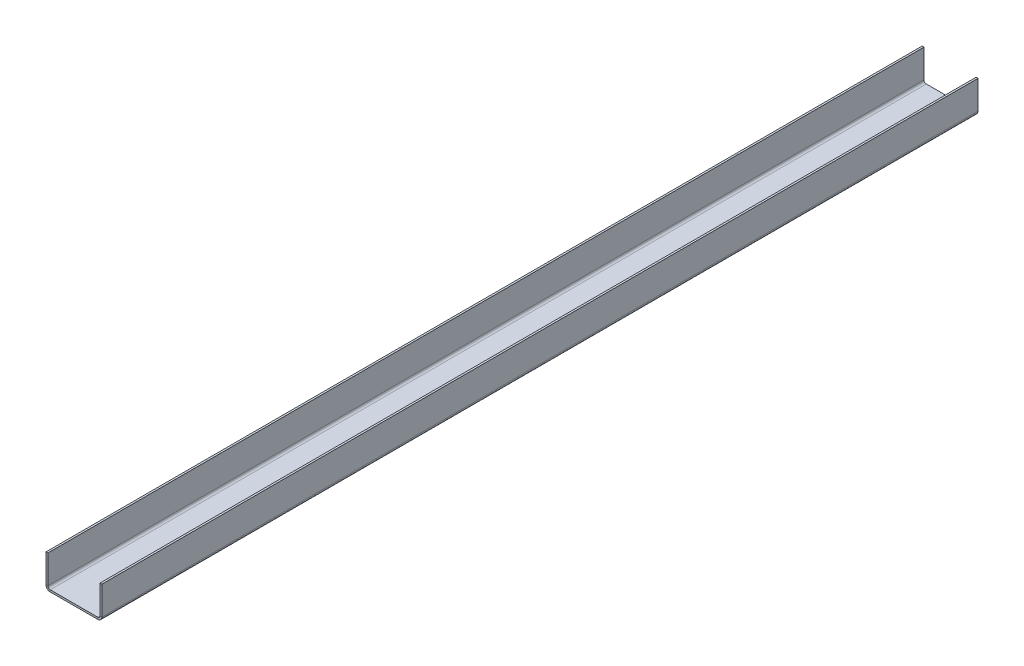
from build123d import *

# Parameters (mm, degrees)
BASE_FLANGE1_DEPTH = 1193.8


# Sheet-metal steps are written as plain solids
with BuildPart() as part:
    # Sketch1 → Base-Flange1 (new body)
    with BuildSketch(Plane.XY):
        with BuildLine():
            Line((-38.1, 44.45), (-38.1, 5.76326))
            ThreePointArc((-38.1, 5.76326), (-36.411980228, 1.688019772), (-32.33674, 0))
            Line((-32.33674, 0), (32.33674, 0))
            ThreePointArc((32.33674, 0), (36.411980228, 1.688019772), (38.1, 5.76326))
            Line((38.1, 5.76326), (38.1, 44.45))
            Line((38.1, 44.45), (35.51174, 44.45))
            Line((35.51174, 44.45), (35.51174, 5.76326))
            ThreePointArc((35.51174, 5.76326), (34.58180403, 3.51819597), (32.33674, 2.58826))
            Line((32.33674, 2.58826), (-32.33674, 2.58826))
            ThreePointArc((-32.33674, 2.58826), (-34.58180403, 3.51819597), (-35.51174, 5.76326))
            Line((-35.51174, 5.76326), (-35.51174, 44.45))
            Line((-35.51174, 44.45), (-38.1, 44.45))
        make_face()
    extrude(amount=BASE_FLANGE1_DEPTH)


solid = part.part
